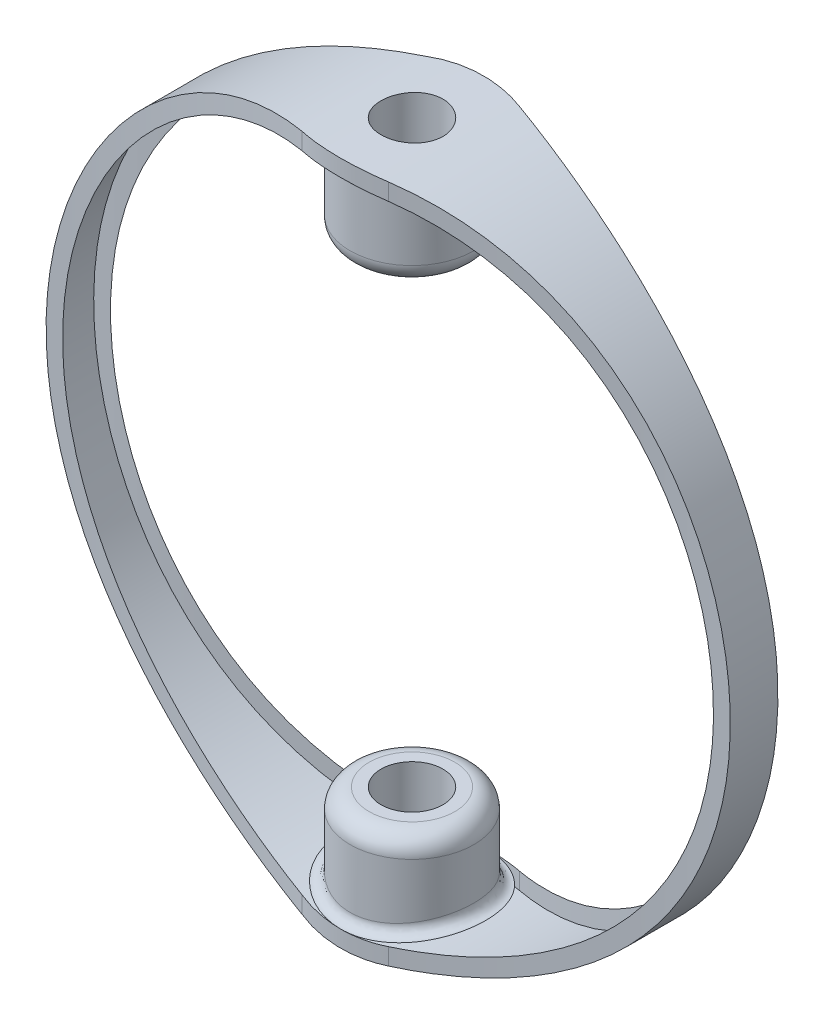
from build123d import *

# Parameters (mm, degrees)
SKETCH1_R           = 35.9225
SKETCH1_R_2         = 34.1698
BOSS_EXTRUDE1_DEPTH = 15
SKETCH2_R           = 3.25
CUT_EXTRUDE1_DEPTH  = 50
SKETCH2_4_R         = 6.5
SKETCH2_4_R_2       = 3.25
BOSS_EXTRUDE3_DEPTH = 35
SKETCH2_7_R         = 6.5
SKETCH2_7_R_2       = 3.25
CUT_EXTRUDE4_DEPTH  = 25
CUT_EXTRUDE5_DEPTH  = 100
FILLET3_R           = 2
FILLET4_R           = 2
FILLET6_R           = 1


with BuildPart() as part:
    # Sketch1 → Boss-Extrude1 (new body)
    with BuildSketch(Plane.XY):
        Circle(SKETCH1_R)
        Circle(SKETCH1_R_2, mode=Mode.SUBTRACT)
    extrude(amount=BOSS_EXTRUDE1_DEPTH)

    # Sketch2 → Cut-Extrude1 (cut, symmetric)
    with BuildSketch(Plane(origin=(0, 0, 0), x_dir=(1, 0, 0), z_dir=(0, 1, 0))):
        with Locations(Location((0, -7.5, 0), (0, 0, 270))):
            Circle(SKETCH2_R)
    extrude(amount=CUT_EXTRUDE1_DEPTH, both=True, mode=Mode.SUBTRACT)

    # Sketch2<4> → Boss-Extrude3 (add, symmetric)
    with BuildSketch(Plane(origin=(0, 0, 0), x_dir=(1, 0, 0), z_dir=(0, 1, 0))):
        with Locations(Location((0, -7.5, 0), (0, 0, 90))):
            Circle(SKETCH2_4_R)
        with Locations(Location((0, -7.5, 0), (0, 0, 270))):
            Circle(SKETCH2_4_R_2, mode=Mode.SUBTRACT)
    extrude(amount=BOSS_EXTRUDE3_DEPTH, both=True)

    # Sketch2<7> → Cut-Extrude4 (cut, symmetric)
    with BuildSketch(Plane(origin=(0, 0, 0), x_dir=(1, 0, 0), z_dir=(0, 1, 0))):
        with Locations(Location((0, -7.5, 0), (0, 0, 90))):
            Circle(SKETCH2_7_R)
        with Locations(Location((0, -7.5, 0), (0, 0, 270))):
            Circle(SKETCH2_7_R_2, mode=Mode.SUBTRACT)
    extrude(amount=CUT_EXTRUDE4_DEPTH, both=True, mode=Mode.SUBTRACT)

    # Sketch7 → Cut-Extrude5 (cut, symmetric)
    with BuildSketch(Plane(origin=(0, -25, 0), x_dir=(1, 0, 0), z_dir=(0, 1, 0))):
        with BuildLine():
            Line((35.9225, -5), (35.9225, 0))
            Line((35.9225, 0), (0, 0))
            add(Edge.make_bspline(
                [(4.090641388, -0.536576486), (2.121199755, 0), (0, 0)],
                knots=[4.331828157, 4.331828157, 4.331828157, 4.71238898, 4.71238898, 4.71238898], degree=2, weights=[1, 0.981951238, 1]))
            add(Edge.make_bspline(
                [(4.400166369, -0.624654431), (4.246388876, -0.579010056), (4.090641388, -0.536576486)],
                knots=[4.301366423, 4.301366423, 4.301366423, 4.331828157, 4.331828157, 4.331828157], degree=2, weights=[1, 0.999884013, 1]))
            ThreePointArc((4.400166369, -0.624654431), (20.010231413, -3.900945335), (35.9225, -5))
        make_face()
        with BuildLine():
            add(Edge.make_bspline(
                [(0, -15), (2.121199755, -15), (4.090641388, -14.463423514)],
                knots=[1.570796327, 1.570796327, 1.570796327, 1.951357151, 1.951357151, 1.951357151], degree=2, weights=[1, 0.981951238, 1]))
            Line((0, -15), (35.9225, -15))
            Line((35.9225, -15), (35.9225, -10))
            ThreePointArc((35.9225, -10), (20.010231413, -11.099054665), (4.400166369, -14.375345569))
            add(Edge.make_bspline(
                [(4.090641388, -14.463423514), (4.246388876, -14.420989944), (4.400166369, -14.375345569)],
                knots=[1.951357151, 1.951357151, 1.951357151, 1.981818884, 1.981818884, 1.981818884], degree=2, weights=[1, 0.999884013, 1]))
        make_face()
        with BuildLine():
            add(Edge.make_bspline(
                [(0, 0), (-1.598076153, 0), (-3.130239484, -0.309338302)],
                knots=[4.71238898, 4.71238898, 4.71238898, 5.000596523, 5.000596523, 5.000596523], degree=2, weights=[1, 0.989635007, 1]))
            Line((0, 0), (-35.9225, 0))
            Line((-35.9225, 0), (-35.9225, -5))
            ThreePointArc((-35.9225, -5), (-20.449097493, -3.972032891), (-5.247664391, -0.906199703))
            add(Edge.make_bspline(
                [(-3.130239484, -0.309338302), (-4.234793741, -0.532343859), (-5.247664391, -0.906199703)],
                knots=[5.000596523, 5.000596523, 5.000596523, 5.209060675, 5.209060675, 5.209060675], degree=2, weights=[1, 0.994572753, 1]))
        make_face()
        with BuildLine():
            Line((-35.9225, -15), (0, -15))
            add(Edge.make_bspline(
                [(-3.677180914, -14.569569335), (-1.892908172, -15), (0, -15)],
                knots=[1.230360534, 1.230360534, 1.230360534, 1.570796327, 1.570796327, 1.570796327], degree=2, weights=[1, 0.985547879, 1]))
            add(Edge.make_bspline(
                [(-4.784471186, -14.255245547), (-4.243413838, -14.432973618), (-3.677180914, -14.569569335)],
                knots=[1.121376731, 1.121376731, 1.121376731, 1.230360534, 1.230360534, 1.230360534], degree=2, weights=[1, 0.998515684, 1]))
            ThreePointArc((-4.784471186, -14.255245547), (-20.208780253, -11.068732286), (-35.9225, -10))
            Line((-35.9225, -10), (-35.9225, -15))
        make_face()
    extrude(amount=CUT_EXTRUDE5_DEPTH, both=True, mode=Mode.SUBTRACT)

    # Fillet3
    fillet3_edges = [part.edges().sort_by_distance(p)[0] for p in [
        (0, 25, 14),
    ]]
    fillet(fillet3_edges, radius=FILLET3_R)

    # Fillet4
    fillet4_edges = [part.edges().sort_by_distance(p)[0] for p in [
        (0, -25, 14),
    ]]
    fillet(fillet4_edges, radius=FILLET4_R)

    # Fillet6
    fillet6_edges = [part.edges().sort_by_distance(p)[0] for p in [
        (-4.2604e-05, 34.1698, 13.999999999),
        (-4.2583e-05, -34.1698, 13.999999999),
    ]]
    fillet(fillet6_edges, radius=FILLET6_R - 0.0001)  # a hair under: the kernel refuses the full size


solid = part.part
